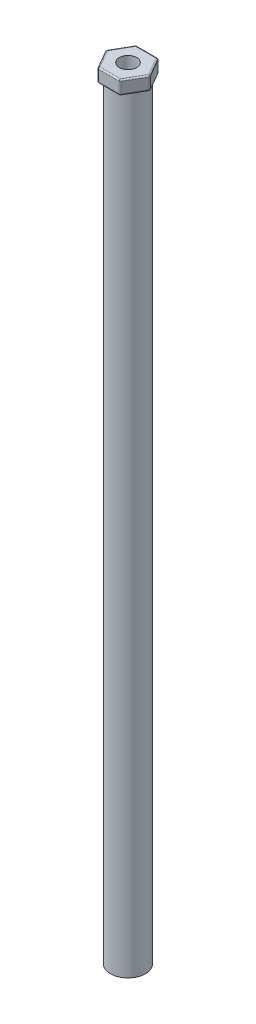
from build123d import *

# Parameters (mm, degrees)
SKETCH1_R           = 6.35
SKETCH1_R_2         = 3.175
BOSS_EXTRUDE1_DEPTH = 279.4
SKETCH2_R           = 3.175
BOSS_EXTRUDE2_DEPTH = 5
FILLET1_R           = 0.5


with BuildPart() as part:
    # Sketch1 → Boss-Extrude1 (new body)
    with BuildSketch(Plane(origin=(0, 0, 0), x_dir=(1, 0, 0), z_dir=(0, 1, 0))):
        Circle(SKETCH1_R)
        Circle(SKETCH1_R_2, mode=Mode.SUBTRACT)
    extrude(amount=BOSS_EXTRUDE1_DEPTH)

    # Sketch2 → Boss-Extrude2 (add)
    with BuildSketch(Plane(origin=(0, 279.4, 0), x_dir=(1, 0, 0), z_dir=(0, 1, 0))):
        Polygon((-8.065583261, 0), (-4.03279163, -6.985), (4.03279163, -6.985), (8.065583261, 0), (4.03279163, 6.985), (-4.03279163, 6.985), align=None)
        Circle(SKETCH2_R, mode=Mode.SUBTRACT)
    extrude(amount=BOSS_EXTRUDE2_DEPTH)

    # Fillet1
    fillet1_edges = [part.edges().sort_by_distance(p)[0] for p in [
        (6.049187445, 279.4, -3.4925),
        (4.03279163, 281.9, -6.985),
        (8.065583261, 281.9, 0),
        (-4.03279163, 281.9, -6.985),
        (-6.049187445, 279.4, -3.4925),
        (-8.065583261, 281.9, 0),
        (-6.049187445, 279.4, 3.4925),
        (-4.03279163, 281.9, 6.985),
        (0, 279.4, 6.985),
        (6.049187445, 279.4, 3.4925),
        (4.03279163, 281.9, 6.985),
        (6.049187445, 284.4, 3.4925),
        (6.049187445, 284.4, -3.4925),
        (0, 284.4, -6.985),
        (-6.049187445, 284.4, -3.4925),
        (-6.049187445, 284.4, 3.4925),
        (0, 284.4, 6.985),
        (0, 279.4, -6.985),
    ]]
    fillet(fillet1_edges, radius=FILLET1_R)


solid = part.part
